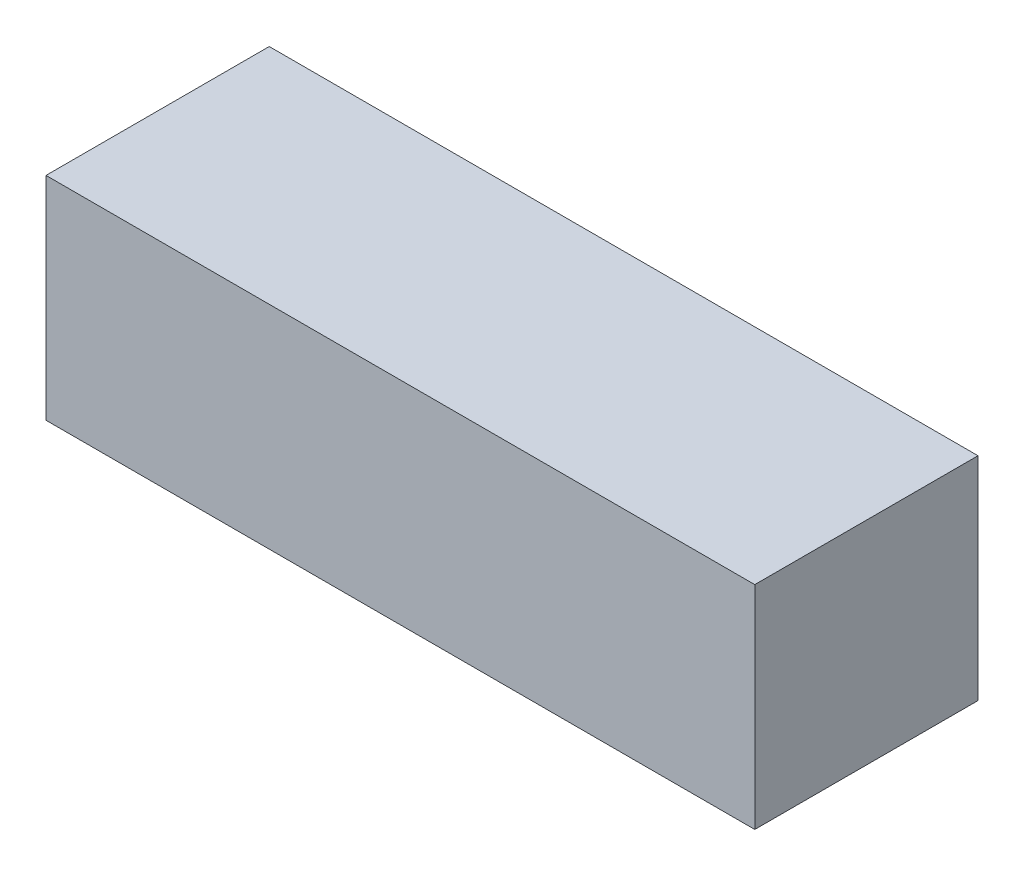
from build123d import *

# Parameters (mm, degrees)
BOSS_EXTRUDE1_DEPTH      = 14
BOSS_EXTRUDE1_DEPTH_BACK = 14
SKETCH1_W                = 115
SKETCH1_H                = 35
BOSS_EXTRUDE2_DEPTH      = 19
BOSS_EXTRUDE2_DEPTH_BACK = 19
SKETCH2_W                = 127
SKETCH2_H                = 40


with BuildPart() as part:
    # Sketch1 → Boss-Extrude1 (new, two sides: drawn at the far end of the back side and taken through both)
    with BuildSketch(Plane(origin=(0, 0, 0), x_dir=(1, 0, 0), z_dir=(0, 1, 0)).offset(-BOSS_EXTRUDE1_DEPTH_BACK)):
        Rectangle(SKETCH1_W, SKETCH1_H)
    extrude(amount=BOSS_EXTRUDE1_DEPTH + BOSS_EXTRUDE1_DEPTH_BACK)


with BuildPart() as body_2:
    # Sketch2 → Boss-Extrude2 (new, two sides: drawn at the far end of the back side and taken through both)
    with BuildSketch(Plane(origin=(0, 0, 0), x_dir=(1, 0, 0), z_dir=(0, 1, 0)).offset(-BOSS_EXTRUDE2_DEPTH_BACK)):
        with Locations((-4, 0)):
            Rectangle(SKETCH2_W, SKETCH2_H)
    extrude(amount=BOSS_EXTRUDE2_DEPTH + BOSS_EXTRUDE2_DEPTH_BACK)


solid = Compound([part.part, body_2.part])
